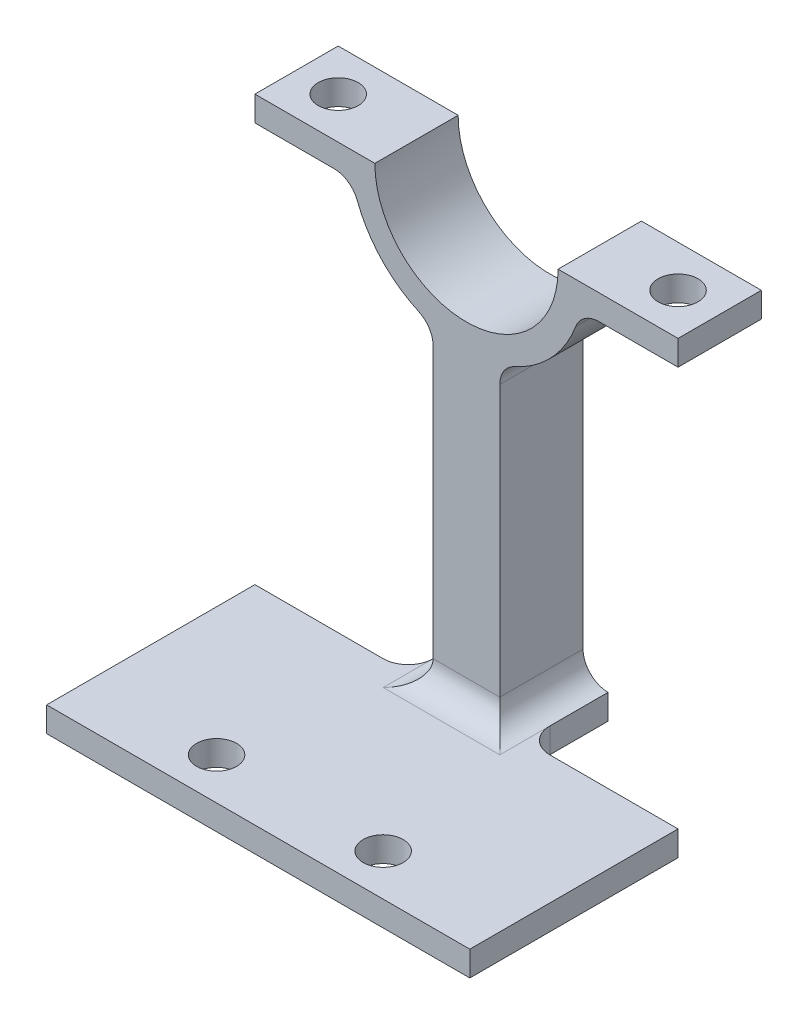
from build123d import *

# Parameters (mm, degrees)
BOSS_EXTRUDE1_DEPTH      = 2.5
SKETCH2_R                = 1.2
CUT_EXTRUDE1_DEPTH       = 15.715298162
BOSS_EXTRUDE2_REACH      = 42.215
BOSS_EXTRUDE2_END_RADIUS = 7
BOSS_EXTRUDE2_START      = -25.5
SKETCH6_W                = 4
SKETCH6_H                = 5
BOSS_EXTRUDE4_DEPTH      = 1.5
FILLET1_R                = 1.5
SKETCH8_R                = 1.2
CUT_EXTRUDE3_DEPTH       = 34.395957839


with BuildPart() as part:
    # Sketch1 → Boss-Extrude1 (new, symmetric)
    with BuildSketch(Plane.XY):
        with BuildLine():
            Line((5.5, 0), (12.7, 0))
            Line((12.7, 0), (12.7, -1.5))
            Line((12.7, -1.5), (6.837397166, -1.5))
            ThreePointArc((6.837397166, -1.5), (0, -7), (-6.837397166, -1.5))
            Line((-6.837397166, -1.5), (-12.7, -1.5))
            Line((-12.7, -1.5), (-12.7, 0))
            Line((-12.7, 0), (-5.5, 0))
            ThreePointArc((-5.5, 0), (0, -5.5), (5.5, 0))
        make_face()
    extrude(amount=BOSS_EXTRUDE1_DEPTH, both=True)

    # Sketch2 → Cut-Extrude1 (cut, through all)
    with BuildSketch(Plane(origin=(0, 0, 0), x_dir=(1, 0, 0), z_dir=(0, 1, 0))):
        with Locations(Location((-10.2, 0, 0), (0, 0, 270))):
            Circle(SKETCH2_R)
        with Locations(Location((10.2, 0, 0), (0, 0, 270))):
            Circle(SKETCH2_R)
    extrude(amount=-CUT_EXTRUDE1_DEPTH, mode=Mode.SUBTRACT)

    # Boss-Extrude2: up to this cylinder (the profile starts outside it)
    boss_extrude2_end = Plane(origin=(0, 0, 0), z_dir=(0, 0, -1)) * Cylinder(BOSS_EXTRUDE2_END_RADIUS, 99.43, mode=Mode.PRIVATE)
    # Sketch6 → Boss-Extrude2 (add, up to the surface)
    with BuildSketch(Plane(origin=(0, 0, 0), x_dir=(1, 0, 0), z_dir=(0, 1, 0)).offset(BOSS_EXTRUDE2_START), mode=Mode.PRIVATE) as boss_extrude2_sk1:
        Rectangle(SKETCH6_W, SKETCH6_H)
    boss_extrude2_tool1 = extrude(boss_extrude2_sk1.sketch, amount=BOSS_EXTRUDE2_REACH, mode=Mode.PRIVATE) - boss_extrude2_end
    add(boss_extrude2_tool1.solids().sort_by_distance((0, -25.5, 0))[0])

    # Sketch7 → Boss-Extrude4 (add)
    with BuildSketch(Plane.XZ.offset(25.5)):
        Polygon((3.5, -2.5), (-3.5, -2.5), (-3.5, 2.5), (-12.7, 2.5), (-12.7, 15), (12.7, 15), (12.7, 2.5), (3.5, 2.5), align=None)
    extrude(amount=BOSS_EXTRUDE4_DEPTH)

    # Fillet1
    fillet1_edges = [part.edges().sort_by_distance(p)[0] for p in [
        (2, -25.5, 0),
        (-2, -25.5, 0),
        (-6.837397166, -1.5, 0),
        (-2, -6.708203932, 0),
        (2, -6.708203932, 0),
        (6.837397166, -1.5, 0),
        (3.5, -26.25, 2.5),
        (-3.5, -26.25, 2.5),
        (0, -25.5, 2.5),
    ]]
    fillet(fillet1_edges, radius=FILLET1_R - 0.0001)  # a hair under: the kernel refuses the full size

    # Sketch8 → Cut-Extrude3 (cut, through all)
    with BuildSketch(Plane(origin=(0, 0, 0), x_dir=(1, 0, 0), z_dir=(0, 1, 0))):
        with Locations(Location((-5, -12.5, 0), (0, 0, 270))):
            Circle(SKETCH8_R)
        with Locations(Location((5, -12.5, 0), (0, 0, 270))):
            Circle(SKETCH8_R)
    extrude(amount=-CUT_EXTRUDE3_DEPTH, mode=Mode.SUBTRACT)


solid = part.part
